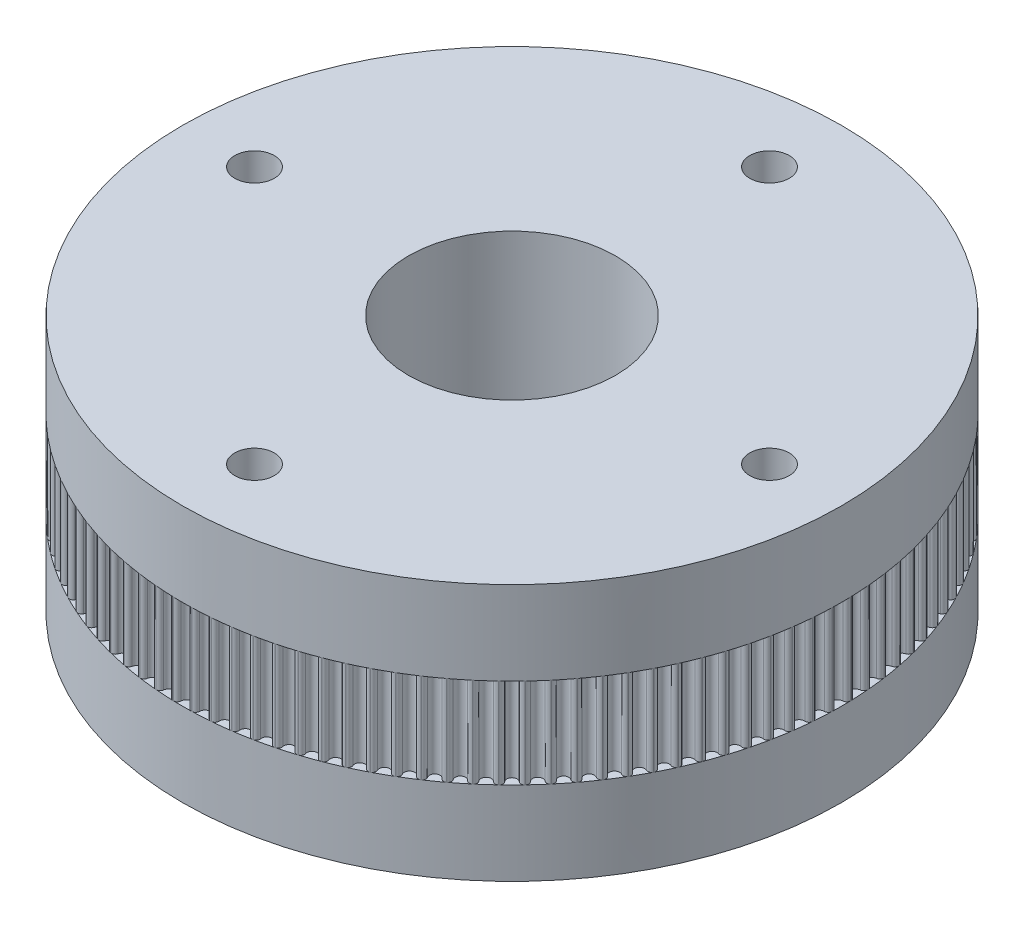
from build123d import *
from build123d.topology import SkipClean

# Parameters (mm, degrees)
CUT_EXTRUDE3_DEPTH  = 25
CIRPATTERN1_COUNT   = 112
SKETCH7_R           = 2.1
CUT_EXTRUDE5_DEPTH  = 51.392236372
CIRPATTERN2_COUNT   = 4
CIRPATTERN2_ANGLE   = 270
BOSS_EXTRUDE1_START = 8.875
SKETCH8_R           = 35
SKETCH8_R_2         = 2.1
SKETCH8_R_3         = 11
BOSS_EXTRUDE1_DEPTH = 8.875


with BuildPart() as part:
    # Skica2 → Revolute (revolve)
    with BuildSketch(Plane.XY):
        Polygon((12.5, 4.775), (11, 4.775), (11, -4.775), (36, -4.775), (36, -3.775), (35, -3.775), (35, 3.775), (36, 3.775), (36, 4.775), align=None)
    revolve(axis=Axis((0, -9, 0), (0, 1, 0)))

    # Sketch2 → Cut-Extrude3 (cut, symmetric)
    with SkipClean():  # the faces are left unmerged after this step: merging them gives an invalid solid
        with BuildSketch(Plane.XZ.offset(-3.775)):
            with BuildLine():
                ThreePointArc((-0.549870829, 34.59563039), (0, 34.057549754), (0.549870829, 34.59563039))
                ThreePointArc((0.549870829, 34.59563039), (0.673966395, 34.876666046), (0.960756966, 34.98681103))
                ThreePointArc((0.960756966, 34.98681103), (1.741617328, 34.956641273), (2.521609506, 34.909045898))
                ThreePointArc((2.521609506, 34.909045898), (1.685070228, 36.378232566), (0, 36.240952722))
                ThreePointArc((0, 36.240952722), (-1.685070228, 36.378232566), (-2.521609506, 34.909045898))
                ThreePointArc((-2.521609506, 34.909045898), (-1.741617328, 34.956641273), (-0.960756966, 34.98681103))
                ThreePointArc((-0.960756966, 34.98681103), (-0.673966395, 34.876666046), (-0.549870829, 34.59563039))
            make_face()
        cut_extrude3 = extrude(amount=CUT_EXTRUDE3_DEPTH, both=True, mode=Mode.SUBTRACT)

    # CirPattern1: Cut-Extrude3 ×112 about axis
    with SkipClean():  # the faces are left unmerged after this step: merging them gives an invalid solid
        cirpattern1_axis = Axis((0, -9, 0), (0, -1, 0))
        for i in range(1, CIRPATTERN1_COUNT):
            add(cut_extrude3.rotate(cirpattern1_axis, i * 360 / CIRPATTERN1_COUNT), mode=Mode.SUBTRACT)

    # Sketch7 → Cut-Extrude5 (cut, through all)
    with BuildSketch(Plane.XZ.offset(4.775)):
        with Locations((-27.35, 0)):
            Circle(SKETCH7_R)
    cut_extrude5 = extrude(amount=-CUT_EXTRUDE5_DEPTH, mode=Mode.SUBTRACT)

    # CirPattern2: Cut-Extrude5 ×4 about axis
    cirpattern2_axis = Axis((0, -4.775, 0), (0, -1, 0))
    for i in range(1, CIRPATTERN2_COUNT):
        add(cut_extrude5.rotate(cirpattern2_axis, i * CIRPATTERN2_ANGLE / (CIRPATTERN2_COUNT - 1)), mode=Mode.SUBTRACT)

    # Sketch8 → Boss-Extrude1 (add)
    with BuildSketch(Plane.XZ.offset(4.775).offset(BOSS_EXTRUDE1_START)):
        Circle(SKETCH8_R)
        with Locations((0, -27.35)):
            Circle(SKETCH8_R_2, mode=Mode.SUBTRACT)
        with Locations((-27.35, 0)):
            Circle(SKETCH8_R_2, mode=Mode.SUBTRACT)
        with Locations((0, 27.35)):
            Circle(SKETCH8_R_2, mode=Mode.SUBTRACT)
        Circle(SKETCH8_R_3, mode=Mode.SUBTRACT)
        with Locations((27.35, 0)):
            Circle(SKETCH8_R_2, mode=Mode.SUBTRACT)
    boss_extrude1 = extrude(amount=-BOSS_EXTRUDE1_DEPTH)

    # Mirror2: Boss-Extrude1 across plane
    add(boss_extrude1.mirror(Plane.ZX))


solid = part.part
